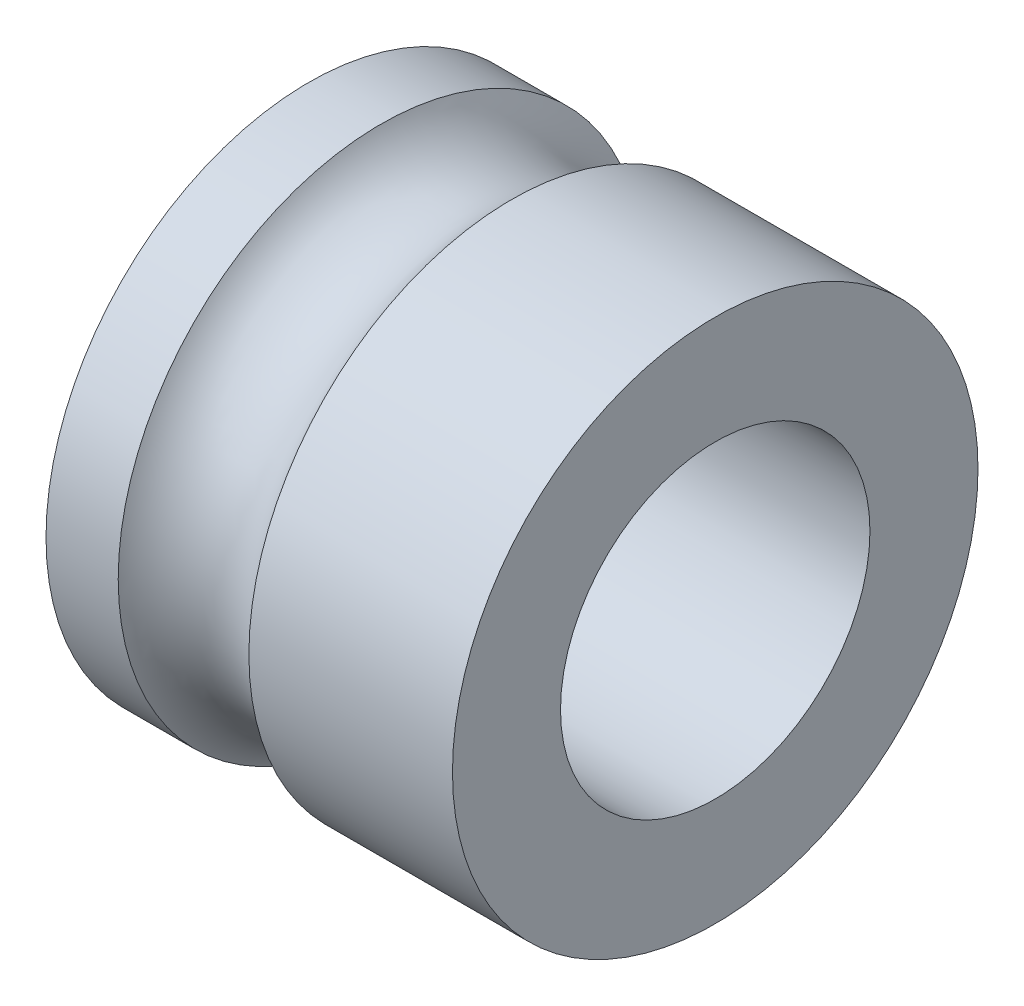
from build123d import *

# Parameters (mm, degrees)
SCALE1_SCALE        = 6
SKETCH4_R           = 45.852
BOSS_EXTRUDE1_DEPTH = 12.7
SKETCH5_R           = 27
CUT_EXTRUDE1_DEPTH  = 84.317043923
SCALE2_SCALE        = 3.323882225
SKETCH7_R           = 152.406647765
SKETCH7_R_2         = 89.744820066
BOSS_EXTRUDE2_DEPTH = 33.99


with BuildPart() as part:
    # Sketch1 → Revolve1 (revolve)
    with BuildSketch(Plane.XY):
        with BuildLine():
            Line((0, 0), (4, 0))
            Line((4, 0), (4, 3.142))
            Line((4, 3.142), (1.9, 3.142))
            ThreePointArc((1.9, 3.142), (0, 2.051053651), (-1.9, 3.142))
            Line((-1.9, 3.142), (-4, 3.142))
            Line((-4, 3.142), (-4, 0))
            Line((-4, 0), (0, 0))
        make_face()
    revolve(axis=Axis((-4, -4.5, 0), (1, 0, 0)))


with BuildPart() as part_1:
    # Scale1: scaled about (0, -4.5, 0)
    add(part.part.scale(SCALE1_SCALE).moved(Location((0, 22.5, 0))))

    # Sketch4 → Boss-Extrude1 (add)
    with BuildSketch(Plane(origin=(24, 0, 0), x_dir=(0, 0, -1), z_dir=(1, 0, 0))):
        with Locations((0, -4.5)):
            Circle(SKETCH4_R)
    extrude(amount=BOSS_EXTRUDE1_DEPTH)

    # Sketch5 → Cut-Extrude1 (cut, through all)
    with BuildSketch(Plane.ZY.offset(-24)):
        with Locations((0, -4.5)):
            Circle(SKETCH5_R)
    extrude(amount=-CUT_EXTRUDE1_DEPTH, mode=Mode.SUBTRACT)


with BuildPart() as part_2:
    # Scale2: scaled about (7.131190873, -4.5, 0)
    add(part_1.part.scale(SCALE2_SCALE).moved(Location((-16.57204771, 10.457470011, 0))))

    # Sketch7 → Boss-Extrude2 (add)
    with BuildSketch(Plane(origin=(105.414429934, 0, 0), x_dir=(0, 0, -1), z_dir=(1, 0, 0))):
        with Locations((0, -4.5)):
            Circle(SKETCH7_R)
        with Locations((0, -4.5)):
            Circle(SKETCH7_R_2, mode=Mode.SUBTRACT)
    extrude(amount=BOSS_EXTRUDE2_DEPTH)


solid = part_2.part
